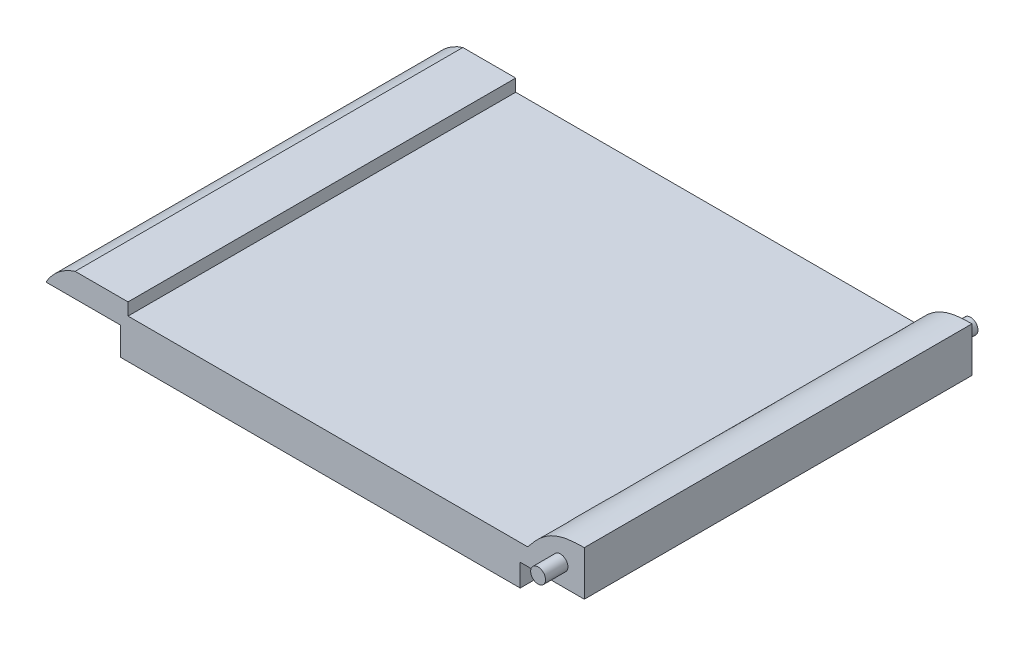
from build123d import *

# Parameters (mm, degrees)
BOSS_EXTRUDE3_DEPTH = 26
FILLET6_DEPTH       = 26
SKETCH6_R           = 0.5
BOSS_EXTRUDE6_DEPTH = 1.5
LPATTERN1_COUNT     = 2
LPATTERN1_PITCH     = 27.5


with BuildPart() as part:
    # Sketch4 → Boss-Extrude3 (new body)
    with BuildSketch(Plane.XY):
        with BuildLine():
            Line((-16.882676832, -0.738323828), (9.917323168, -0.738323828))
            Line((9.917323168, -0.738323828), (9.917323168, 0.761676172))
            Line((9.917323168, 0.761676172), (14.217323168, 0.761676172))
            Line((14.217323168, 0.761676172), (14.217323168, 3.761676172))
            Line((14.217323168, 3.761676172), (10.417323168, 3.761676172))
            Line((10.417323168, 3.761676172), (10.417323168, 1.907320096))
            Line((10.417323168, 1.907320096), (-16.382676832, 1.907320096))
            Line((-16.382676832, 1.907320096), (-16.382676832, 2.732812963))
            Line((-16.382676832, 2.732812963), (-19.929938074, 2.732812963))
            ThreePointArc((-19.929938074, 2.732812963), (-21.061793852, 2.121559656), (-21.882676832, 1.131166179))
            Line((-21.882676832, 1.131166179), (-16.882676832, 1.131166179))
            Line((-16.882676832, 1.131166179), (-16.882676832, -0.738323828))
        make_face()
    extrude(amount=BOSS_EXTRUDE3_DEPTH)

    # Fillet6: read off the stored shape, not the designer's step
    # Fillet6 outline → Fillet6 (cut)
    with BuildSketch(Plane.XY):
        with BuildLine():
            Line((10.417323168, 3.761676172), (10.417323168, 1.907320096))
            add(Edge.make_bspline(
                [(10.417323168, 1.907320096), (10.684335221, 2.237350554), (10.951347275, 2.567381012), (11.617088855, 3.247333717), (12.422778443, 3.640500924), (13.36841604, 3.74688263), (13.792869604, 3.754279401), (14.217323168, 3.761676172)],
                knots=[0, 0, 0, 0, 0, 0, 0.5, 0.5, 1, 1, 1, 1, 1, 1], degree=5))
            Line((14.217323168, 3.761676172), (10.417323168, 3.761676172))
        make_face()
    extrude(amount=FILLET6_DEPTH, mode=Mode.SUBTRACT)

    # Sketch6 → Boss-Extrude6 (add)
    with BuildSketch(Plane.XY.offset(26)):
        with Locations(Location((12.617323168, 2.091676172, 0), (0, 0, 180))):
            Circle(SKETCH6_R)
    boss_extrude6 = extrude(amount=BOSS_EXTRUDE6_DEPTH)

    # LPattern1: Boss-Extrude6 ×2
    with Locations(*[(0, 0, -i * LPATTERN1_PITCH) for i in range(1, LPATTERN1_COUNT)]):
        add(boss_extrude6)


solid = part.part
